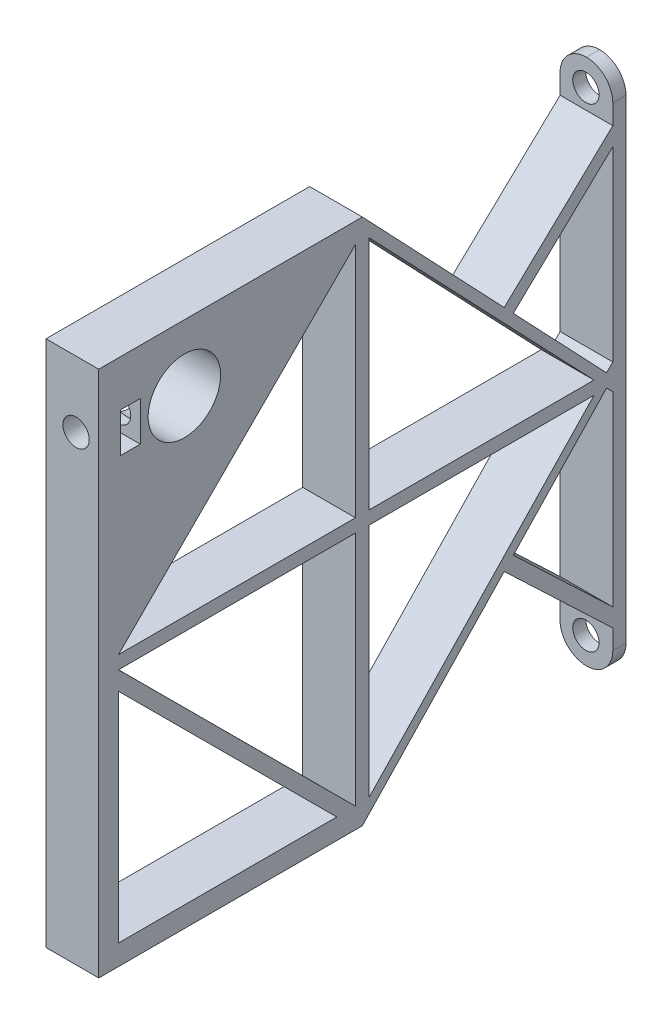
from build123d import *

# Parameters (mm, degrees)
SKETCH1_W                  = 80
SKETCH1_H                  = 80
BOSS_EXTRUDE1_DEPTH        = 8
CUT_EXTRUDE3_DEPTH         = 8
SKETCH5_R                  = 5.5
CUT_EXTRUDE4_DEPTH         = 8
F_4_0MM_DOWEL_HOLE1_D      = 4
F_4_0MM_DOWEL_HOLE1_DEPTH  = 2
F_4_0MM_DOWEL_HOLE2_REACH  = 115.42
F_4_0MM_DOWEL_HOLE2_BORE_R = 2
SKETCH11_W                 = 3
SKETCH11_H                 = 6
CUT_EXTRUDE5_DEPTH         = 8
CUT_EXTRUDE7_DEPTH         = 8
FILLET1_R                  = 4


with BuildPart() as part:
    # Sketch1 → Boss-Extrude1 (new body)
    with BuildSketch(Plane(origin=(0, 0, 0), x_dir=(0, 0, -1), z_dir=(1, 0, 0))):
        with Locations((-40, 40)):
            Rectangle(SKETCH1_W, SKETCH1_H)
    extrude(amount=BOSS_EXTRUDE1_DEPTH)

    # Sketch4 → Cut-Extrude3 (cut)
    with BuildSketch(Plane.ZY):
        Polygon((4.857641634, 41), (39, 76.795358795), (39, 41), align=None)
        Polygon((41.052631579, 76.897437673), (41.052631579, 41), (76.997364954, 41), align=None)
        Polygon((41.052631579, 39), (76.997364954, 39), (41.052631579, 3.102562327), align=None)
        Polygon((39, 39), (39, 3.204641205), (4.857641634, 39), align=None)
        Polygon((2, 7), (2, 0), (40, 0), (18.478318003, 22.654402102), align=None)
        Polygon((2, 9.758622845), (2, 38.05), (2.95, 39), (17.100819079, 24.10440097), align=None)
        Polygon((2, 41.95), (2, 70.241377155), (17.100819079, 55.89559903), (2.95, 41), align=None)
        Polygon((2, 80), (2, 73), (18.478318003, 57.345597898), (40, 80), align=None)
    extrude(amount=-CUT_EXTRUDE3_DEPTH, mode=Mode.SUBTRACT)

    # Sketch5 → Cut-Extrude4 (cut)
    with BuildSketch(Plane(origin=(8, 0, 0), x_dir=(0, 0, -1), z_dir=(1, 0, 0))):
        with Locations((-67, 70)):
            Circle(SKETCH5_R)
    extrude(amount=-CUT_EXTRUDE4_DEPTH, mode=Mode.SUBTRACT)

    # Ø4.0mm Dowel Hole1
    with Locations(Plane(origin=(0, 0, 0), x_dir=(-1, 0, 0), z_dir=(0, 0, -1))):
        with Locations((-3.917697329, 76), (-3.917697329, 4)):
            Hole(F_4_0MM_DOWEL_HOLE1_D / 2, depth=F_4_0MM_DOWEL_HOLE1_DEPTH)

    # Ø4.0mm Dowel Hole2 bore → Ø4.0mm Dowel Hole2 (cut, up to next)
    with BuildSketch(Plane.XY.offset(80), mode=Mode.PRIVATE) as f_4_0mm_dowel_hole2_sk1:
        with Locations((4.558585212, 70)):
            Circle(F_4_0MM_DOWEL_HOLE2_BORE_R)
    f_4_0mm_dowel_hole2_tool1 = extrude(f_4_0mm_dowel_hole2_sk1.sketch, amount=-F_4_0MM_DOWEL_HOLE2_REACH, mode=Mode.PRIVATE) & part.part
    add(f_4_0mm_dowel_hole2_tool1.solids().sort_by_distance((4.558585, 70, 80))[0], mode=Mode.SUBTRACT)

    # Sketch11 → Cut-Extrude5 (cut)
    with BuildSketch(Plane.ZY):
        with Locations((75.2, 70)):
            Rectangle(SKETCH11_W, SKETCH11_H)
    extrude(amount=-CUT_EXTRUDE5_DEPTH, mode=Mode.SUBTRACT)

    # Sketch15 → Cut-Extrude7 (cut)
    with BuildSketch(Plane.ZY):
        Polygon((43.882922576, 3.102562327), (76.997364954, 3.102562327), (76.997364954, 36.17343307), align=None)
    extrude(amount=-CUT_EXTRUDE7_DEPTH, mode=Mode.SUBTRACT)

    # Fillet1
    fillet1_edges = [part.edges().sort_by_distance(p)[0] for p in [
        (8, 0, 1),
        (0, 0, 1),
        (8, 80, 1),
        (0, 80, 1),
    ]]
    fillet(fillet1_edges, radius=FILLET1_R - 0.0001)  # a hair under: the kernel refuses the full size


solid = part.part
